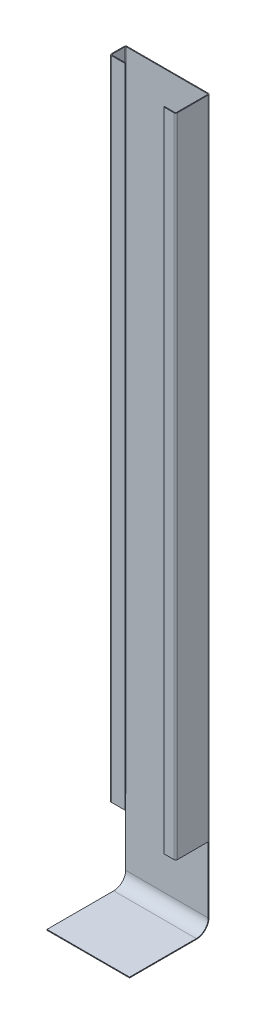
from build123d import *

# Parameters (mm, degrees)
BASE_FLANGE1_DEPTH = 814
EDGE_FLANGE1_DEPTH = 814
SKETCH15_W         = 104
SKETCH15_H         = 84
TAB1_DEPTH         = 1
EDGE_FLANGE2_DEPTH = 104


# Sheet-metal steps are written as plain solids
with BuildPart() as part:
    # Sketch1 → Base-Flange1 (new body)
    with BuildSketch(Plane(origin=(0, 0, 0), x_dir=(1, 0, 0), z_dir=(0, 1, 0))):
        with BuildLine():
            Line((104, 18.695652174), (104, 57.695652174))
            ThreePointArc((104, 57.695652174), (103.707106781, 58.402758955), (103, 58.695652174))
            Line((103, 58.695652174), (1, 58.695652174))
            ThreePointArc((1, 58.695652174), (0.292893219, 58.402758955), (0, 57.695652174))
            Line((0, 57.695652174), (0, 41.695652174))
            ThreePointArc((0, 41.695652174), (0.292893219, 40.988545393), (1, 40.695652174))
            Line((1, 40.695652174), (18, 40.695652174))
            Line((18, 40.695652174), (18, 39.695652174))
            Line((18, 39.695652174), (1, 39.695652174))
            ThreePointArc((1, 39.695652174), (-0.414213562, 40.281438612), (-1, 41.695652174))
            Line((-1, 41.695652174), (-1, 57.695652174))
            ThreePointArc((-1, 57.695652174), (-0.414213562, 59.109865736), (1, 59.695652174))
            Line((1, 59.695652174), (103, 59.695652174))
            ThreePointArc((103, 59.695652174), (104.414213562, 59.109865736), (105, 57.695652174))
            Line((105, 57.695652174), (105, 18.695652174))
            Line((105, 18.695652174), (104, 18.695652174))
        make_face()
    extrude(amount=BASE_FLANGE1_DEPTH)

    # Edge-Flange1 section (across the edge) → Edge-Flange1 (add)
    with BuildSketch(Plane(origin=(104, 0, -17.695652174), x_dir=(0, 0, -1), z_dir=(0, 1, 0))):
        with BuildLine():
            Line((-1, 1), (-1, 14))
            Line((-1, 14), (0, 14))
            Line((0, 14), (0, 1))
            ThreePointArc((0, 1), (0.292893219, 0.292893219), (1, 0))
            Line((1, 0), (1, -1))
            ThreePointArc((1, -1), (-0.414213562, -0.414213562), (-1, 1))
        make_face()
    extrude(amount=EDGE_FLANGE1_DEPTH)

    # Sketch15 → Tab1 (add)
    with BuildSketch(Plane(origin=(0, 0, -59.695652174), x_dir=(-1, 0, 0), z_dir=(0, 0, -1))):
        with Locations((-52, -42)):
            Rectangle(SKETCH15_W, SKETCH15_H)
    extrude(amount=-TAB1_DEPTH)

    # Edge-Flange2 section (across the edge) → Edge-Flange2 (add)
    with BuildSketch(Plane(origin=(0, -99, -58.695652174), x_dir=(0, 1, 0), z_dir=(1, 0, 0))):
        with BuildLine():
            Line((-1, 15), (-1, 99))
            Line((-1, 99), (0, 99))
            Line((0, 99), (0, 15))
            ThreePointArc((0, 15), (4.393398282, 4.393398282), (15, 0))
            Line((15, 0), (15, -1))
            ThreePointArc((15, -1), (3.686291501, 3.686291501), (-1, 15))
        make_face()
    extrude(amount=EDGE_FLANGE2_DEPTH)


solid = part.part
